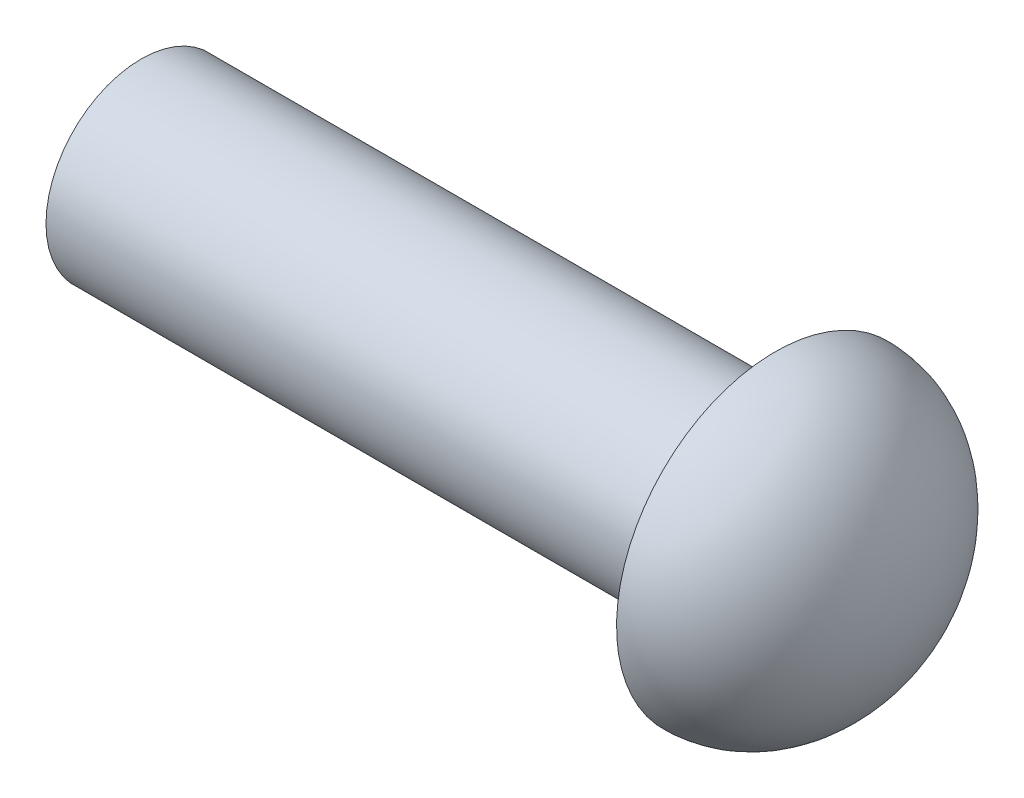
from build123d import *


with BuildPart() as part:
    # Sketch1 → Revolve1 (revolve)
    with BuildSketch(Plane.XY):
        with BuildLine():
            Line((0, 0), (0, -1.5))
            Line((0, -1.5), (10, -1.5))
            Line((10, -1.5), (10, -2.5))
            add(Edge.make_bspline(
                [(10, -2.5), (12, -2.5), (12, 0)],
                knots=[0, 0, 0, 1.570796327, 1.570796327, 1.570796327], degree=2, weights=[1, 0.707106781, 1]))
            Line((12, 0), (0, 0))
        make_face()
    revolve(axis=Axis((12, 0, 0), (-1, 0, 0)))


solid = part.part
